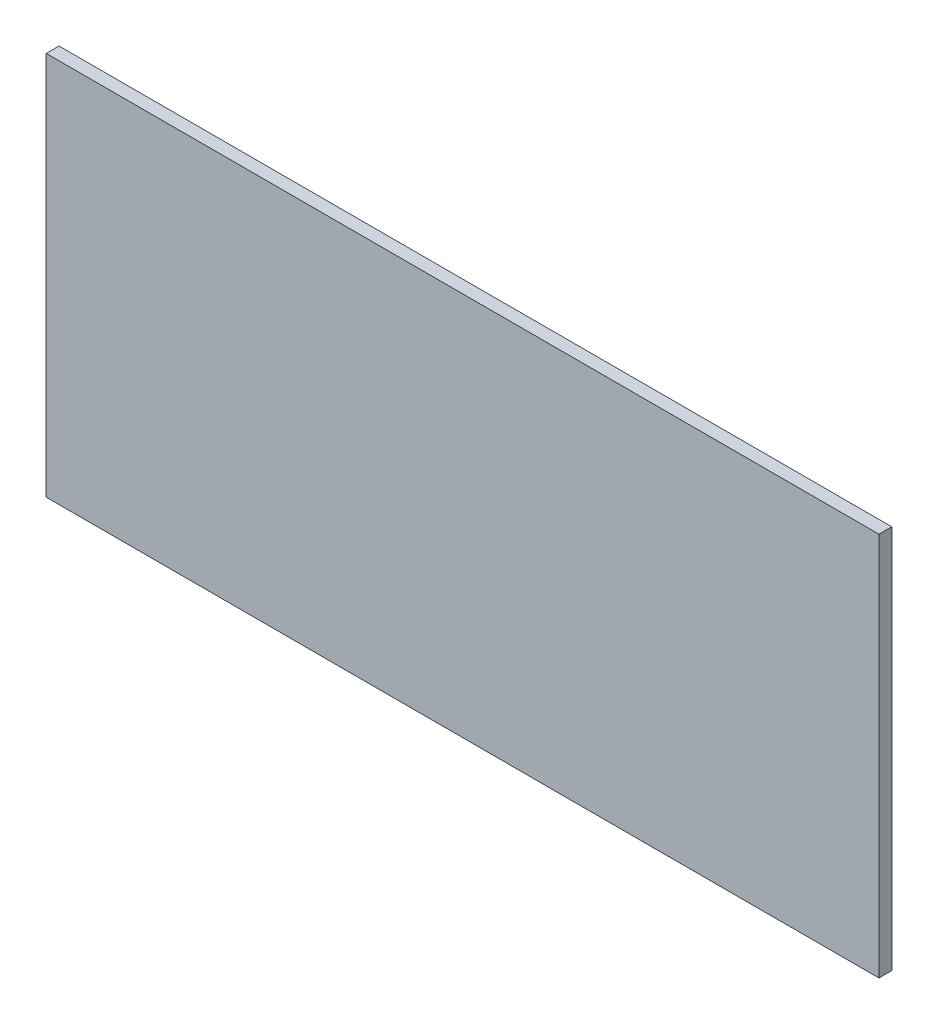
from build123d import *

# Parameters (mm, degrees)
SKETCH1_W           = 65
SKETCH1_H           = 30
BOSS_EXTRUDE1_DEPTH = 1
BOSS_EXTRUDE2_DEPTH = 2


with BuildPart() as part:
    # Sketch1 → Boss-Extrude1 (new body)
    with BuildSketch(Plane.XY):
        with Locations((125.94074046, -0.055)):
            Rectangle(SKETCH1_W, SKETCH1_H)
    extrude(amount=-BOSS_EXTRUDE1_DEPTH)


with BuildPart() as body_2:
    # Sketch2 → Boss-Extrude2 (new body)
    with BuildSketch(Plane(origin=(0, 0, -1), x_dir=(-1, 0, 0), z_dir=(0, 0, -1))):
        with BuildLine():
            Line((-148.44074046, 9.445), (-103.44074046, 9.445))
            ThreePointArc((-103.44074046, 9.445), (-101.672973507, 8.712766953), (-100.94074046, 6.945))
            Line((-100.94074046, 6.945), (-100.94074046, -7.055))
            ThreePointArc((-100.94074046, -7.055), (-101.672973507, -8.822766953), (-103.44074046, -9.555))
            Line((-103.44074046, -9.555), (-148.44074046, -9.555))
            ThreePointArc((-148.44074046, -9.555), (-150.208507413, -8.822766953), (-150.94074046, -7.055))
            Line((-150.94074046, -7.055), (-150.94074046, 6.945))
            ThreePointArc((-150.94074046, 6.945), (-150.208507413, 8.712766953), (-148.44074046, 9.445))
        make_face()
    extrude(amount=BOSS_EXTRUDE2_DEPTH)


solid = Compound([part.part, body_2.part])
